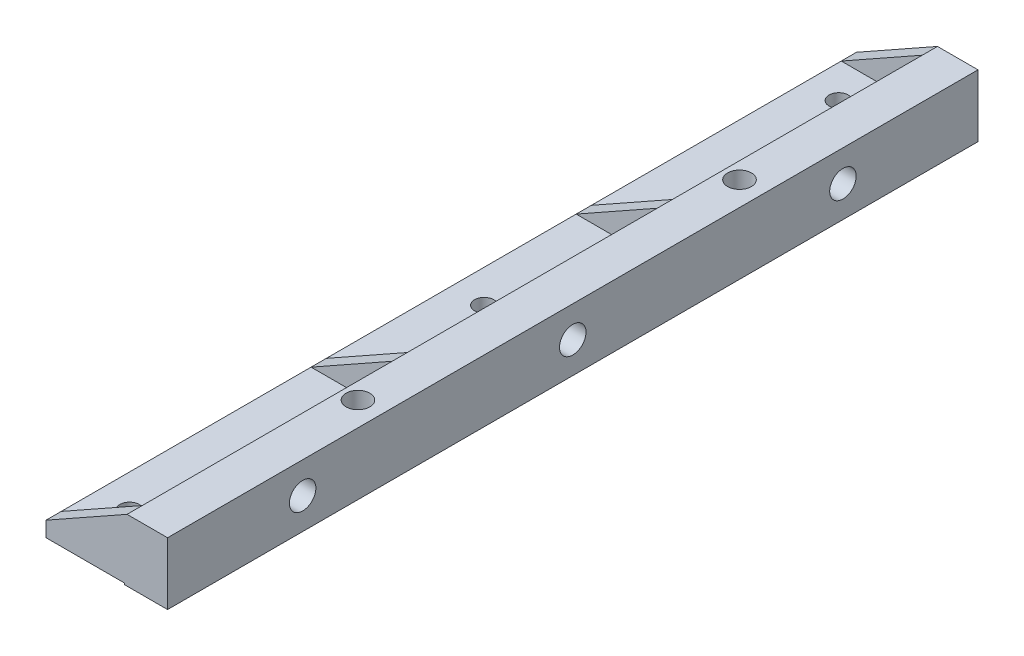
from build123d import *

# Parameters (mm, degrees)
BOSS_EXTRUDE1_DEPTH   = 160
RIB3_REACH            = 111.505
SKETCH4_WALL_W        = 239.367706636
SKETCH4_WALL_H        = 3
RIB4_REACH            = 164.234
SKETCH5_WALL_W        = 344.826356402
SKETCH5_WALL_H        = 3
F_6_CLEARANCE_HOLE1_D = 3.7973
SKETCH18_R            = 2.3495
CUT_EXTRUDE1_DEPTH    = 7.5
SKETCH19_R            = 2.6162
CUT_EXTRUDE2_DEPTH    = 6.35
SKETCH10_R            = 2.3495
CUT_EXTRUDE3_DEPTH    = 163.255727865
SKETCH20_R            = 2.6162
CUT_EXTRUDE4_DEPTH    = 6.35


with BuildPart() as part:
    # Sketch1 → Boss-Extrude1 (new body)
    with BuildSketch(Plane.XY):
        with BuildLine():
            Line((0, 0), (0, 12))
            Line((0, 12), (-8, 12))
            Line((-8, 12), (-8, 6))
            ThreePointArc((-8, 6), (-8.878679656, 3.878679656), (-11, 3))
            Line((-11, 3), (-24, 3))
            Line((-24, 3), (-24, 0))
            Line((-24, 0), (-8.5, 0))
            Line((-8.5, 0), (-8.5, -0.285))
            Line((-8.5, -0.285), (0, -0.285))
            Line((0, -0.285), (0, 0))
        make_face()
    extrude(amount=BOSS_EXTRUDE1_DEPTH)

    # Sketch4 wall → Rib3 (add, up to next)
    with BuildSketch(Plane(origin=(-16, 7.5, 53.83333334), x_dir=(-0.871575537125, -0.490261239633, 0), z_dir=(-0.490261239633, 0.871575537125, 0)), mode=Mode.PRIVATE) as rib3_sk1:
        Rectangle(SKETCH4_WALL_W, SKETCH4_WALL_H)
    rib3_tool1 = extrude(rib3_sk1.sketch, amount=-RIB3_REACH, mode=Mode.PRIVATE) - part.part
    rib3 = rib3_tool1.solids().sort_by_distance((-16, 7.5, 53.83333334))[0]
    add(rib3)

    # Sketch5 wall → Rib4 (add, up to next)
    with BuildSketch(Plane(origin=(-16, 7.5, 0), x_dir=(-0.871575537125, -0.490261239633, 0), z_dir=(-0.490261239633, 0.871575537125, 0)), mode=Mode.PRIVATE) as rib4_sk1:
        with Locations((0, 1.5)):
            Rectangle(SKETCH5_WALL_W, SKETCH5_WALL_H)
    rib4_tool1 = extrude(rib4_sk1.sketch, amount=-RIB4_REACH, mode=Mode.PRIVATE) - part.part
    rib4 = rib4_tool1.solids().sort_by_distance((-16, 7.5, 0))[0]
    add(rib4)

    # Mirror1: Rib3, Rib4 across plane
    add(rib3.mirror(Plane(origin=(0, 0, 80), x_dir=(1, 0, 0), z_dir=(0, 0, -1))))
    add(rib4.mirror(Plane(origin=(0, 0, 80), x_dir=(1, 0, 0), z_dir=(0, 0, -1))))

    # #6 Clearance Hole1 (through all)
    with Locations(Plane(origin=(0, 0, 0), x_dir=(-1, 0, 0), z_dir=(0, -1, 0))):
        with Locations((17.49975, -10), (17.49975, -80), (17.49975, -150)):
            Hole(F_6_CLEARANCE_HOLE1_D / 2)

    # Sketch18 → Cut-Extrude1 (cut)
    with BuildSketch(Plane(origin=(0, 0, 0), x_dir=(0, 0, -1), z_dir=(1, 0, 0))):
        with Locations((-133.333333335, 5.8575)):
            Circle(SKETCH18_R)
        with Locations((-26.666666667, 5.8575)):
            Circle(SKETCH18_R)
        with Locations((-80, 5.8575)):
            Circle(SKETCH18_R)
    extrude(amount=-CUT_EXTRUDE1_DEPTH, mode=Mode.SUBTRACT)

    # Sketch19 → Cut-Extrude2 (cut)
    with BuildSketch(Plane(origin=(0, 0, 0), x_dir=(0, 0, -1), z_dir=(1, 0, 0))):
        with Locations((-133.333333335, 5.8575)):
            Circle(SKETCH19_R)
        with Locations((-26.666666667, 5.8575)):
            Circle(SKETCH19_R)
        with Locations((-80, 5.8575)):
            Circle(SKETCH19_R)
    extrude(amount=-CUT_EXTRUDE2_DEPTH, mode=Mode.SUBTRACT)

    # Sketch10 → Cut-Extrude3 (cut, through all)
    with BuildSketch(Plane(origin=(0, -0.285, 0), x_dir=(-1, 0, 0), z_dir=(0, -1, 0))):
        with Locations((4.749875, -42.33333334)):
            Circle(SKETCH10_R)
        with Locations((4.749875, -117.66666666)):
            Circle(SKETCH10_R)
    extrude(amount=-CUT_EXTRUDE3_DEPTH, mode=Mode.SUBTRACT)

    # Sketch20 → Cut-Extrude4 (cut)
    with BuildSketch(Plane.XZ.offset(0.285)):
        with Locations((-4.749875, 117.66666666)):
            Circle(SKETCH20_R)
        with Locations((-4.749875, 42.33333334)):
            Circle(SKETCH20_R)
    extrude(amount=-CUT_EXTRUDE4_DEPTH, mode=Mode.SUBTRACT)


solid = part.part
